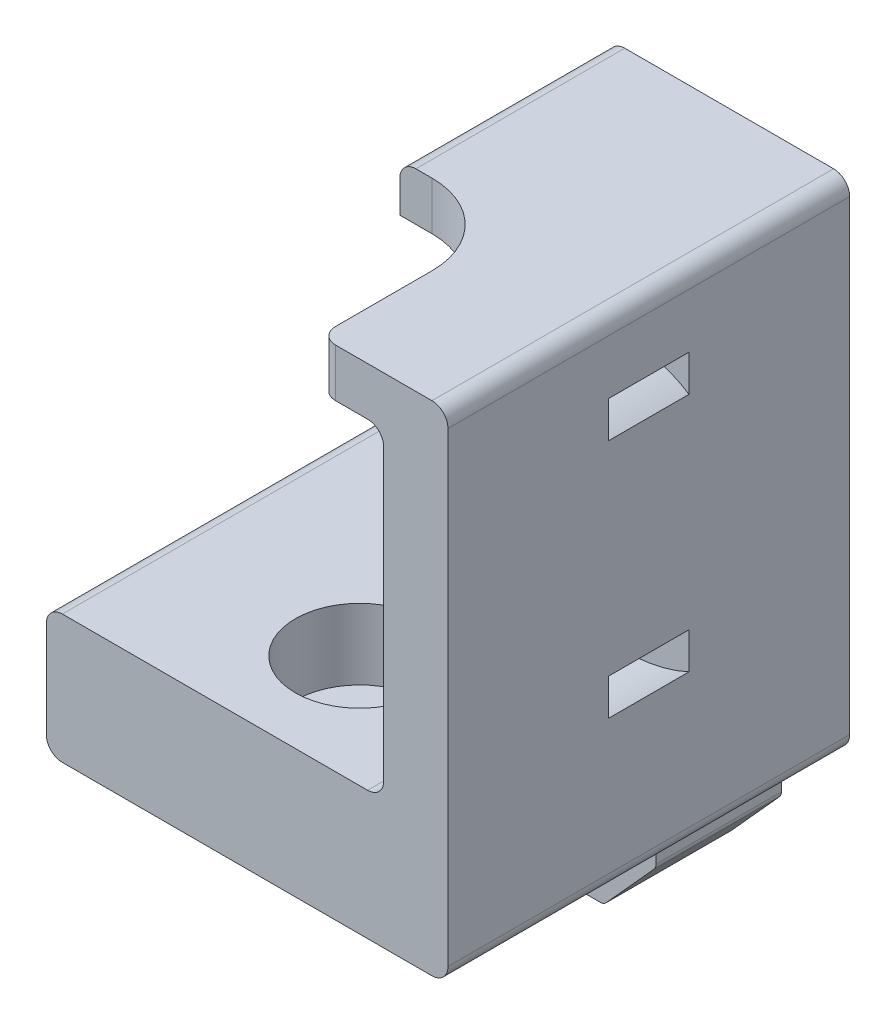
from build123d import *

# Parameters (mm, degrees)
BOSS_EXTRUDE1_DEPTH                                 = 12.5
CBORE_FOR_M4_HEX_SOCKET_HEAD_CAP_SCREW1_D           = 4.5
CBORE_FOR_M4_HEX_SOCKET_HEAD_CAP_SCREW1_DEPTH       = 8
CBORE_FOR_M4_HEX_SOCKET_HEAD_CAP_SCREW1_CBORE_D     = 8
CBORE_FOR_M4_HEX_SOCKET_HEAD_CAP_SCREW1_CBORE_DEPTH = 4.4
BOSS_EXTRUDE3_DEPTH                                 = 7.8
CUT_EXTRUDE3_REACH                                  = 44.819
SKETCH15_W                                          = 6.999999999999991
SKETCH15_H                                          = 12.000000000000002
CUT_EXTRUDE1_DEPTH                                  = 2.4
FILLET3_R                                           = 0.5
SKETCH13_W                                          = 1.9999999999999998
SKETCH13_H                                          = 5
FILLET4_START                                       = 28
FILLET4_DEPTH                                       = 3
FILLET4_START_2                                     = -12.5
FILLET4_2_DEPTH                                     = 25
FILLET4_3_DEPTH                                     = 10
FILLET4_START_3                                     = 2.5
FILLET4_4_DEPTH                                     = 10
FILLET4_START_4                                     = 27
FILLET4_5_DEPTH                                     = 5
FILLET4_START_5                                     = -13
FILLET4_6_DEPTH                                     = 26


with BuildPart() as part:
    # Sketch1 → Boss-Extrude1 (new, symmetric)
    with BuildSketch(Plane.XY):
        Polygon((-12.5, 7.999999999999993), (8.500000000000004, 7.9999999999999885), (8.500000000000004, 27.999999999999982), (-2.4999999999999987, 27.999999999999975), (-2.4999999999999987, 30.99999999999999), (12.5, 31), (12.5, -2.94e-15), (-12.5, -1.41e-15), align=None)
    extrude(amount=BOSS_EXTRUDE1_DEPTH, both=True)

    # CBORE for M4 Hex Socket Head Cap Screw1
    with Locations(Plane(origin=(1.98e-15, 7.999999999999989, 0), x_dir=(1, -1.1e-16, 0), z_dir=(1.1e-16, 1, 0))):
        with Locations((0, -5.5)):
            CounterBoreHole(CBORE_FOR_M4_HEX_SOCKET_HEAD_CAP_SCREW1_D / 2, CBORE_FOR_M4_HEX_SOCKET_HEAD_CAP_SCREW1_CBORE_D / 2, CBORE_FOR_M4_HEX_SOCKET_HEAD_CAP_SCREW1_CBORE_DEPTH, depth=CBORE_FOR_M4_HEX_SOCKET_HEAD_CAP_SCREW1_DEPTH)

    # Sketch5 → Boss-Extrude3 (add)
    with BuildSketch(Plane(origin=(0, 0, -12.5), x_dir=(-1, 0, 0), z_dir=(0, 0, -1))):
        Polygon((-4.999999999999999, -8), (5.000000000000001, -7.999999999999998), (8.249999999999996, -4.400000000000003), (8.25, -2.400000000000003), (3.9000000000000012, -2.400000000000003), (3.9, -3.06e-15), (-3.9, -4.02e-15), (-3.9000000000000004, -2.400000000000004), (-8.25, -2.400000000000005), (-8.249999999999996, -4.400000000000005), align=None)
    extrude(amount=-BOSS_EXTRUDE3_DEPTH)

    # Sketch15 → Cut-Extrude3 (cut, up to next)
    with BuildSketch(Plane(origin=(-2.151e-14, 30.999999999999993, 0), x_dir=(1, 6.9e-16, 0), z_dir=(-6.9e-16, 1, 0)), mode=Mode.PRIVATE) as cut_extrude3_sk1:
        with Locations((1.0000000000000187, -6.500000000000001)):
            Rectangle(SKETCH15_W, SKETCH15_H)
    cut_extrude3_tool1 = extrude(cut_extrude3_sk1.sketch, amount=-CUT_EXTRUDE3_REACH, mode=Mode.PRIVATE) & part.part
    add(cut_extrude3_tool1.solids().sort_by_distance((1, 31, 6.5))[0], mode=Mode.SUBTRACT)

    # Sketch6 → Cut-Extrude1 (cut)
    with BuildSketch(Plane(origin=(0, -2.400000000000003, 0), x_dir=(1, 0, 0), z_dir=(0, 1, 0))):
        with BuildLine():
            ThreePointArc((-3.900000000000001, 8.600000000000001), (-2.7577164466274824, 11.357716446627592), (1.491e-13, 12.500000000000004))
            Line((1.4921e-13, 12.5), (-3.9, 12.5))
            Line((-3.9, 12.5), (-3.9, 8.600000000000005))
        make_face()
        with BuildLine():
            Line((3.9, 4.700000000000001), (3.9000000000000004, 8.600000000000001))
            ThreePointArc((3.9000000000000026, 8.6), (2.7577164513941343, 5.842283558139062), (1.348197454e-08, 4.699999999999999))
            Line((1.348197465e-08, 4.700000000000001), (3.9, 4.700000000000001))
        make_face()
    extrude(amount=CUT_EXTRUDE1_DEPTH, mode=Mode.SUBTRACT)

    # Fillet3
    # the kernel refuses this fillet: 0.5 mm, written as the material it adds along each edge
    with BuildSketch(Plane(origin=(-3.9, -3.06e-15, -4.7), x_dir=(0, 2.38e-15, 1), z_dir=(1, -1.2e-16, 0))) as fillet3_piece_1:
        with BuildLine():
            CenterArc((FILLET3_R, FILLET3_R), FILLET3_R, 180, 90.00000000000011)
            Line((-1.19e-15, FILLET3_R), (0, 0))
            Line((0, 0), (FILLET3_R, 0))
        make_face()
    extrude(amount=3.9000000134819746)
    with BuildSketch(Plane(origin=(-3.9, -3.06e-15, -8.600000000000003), x_dir=(-1, 2.35e-15, 0), z_dir=(0, 0, 1))) as fillet3_piece_2:
        with BuildLine():
            CenterArc((FILLET3_R, FILLET3_R), FILLET3_R, 179.99999999999997, 90.00000000000017)
            Line((-2.51e-15, FILLET3_R), (0, 0))
            Line((0, 0), (FILLET3_R, 0))
        make_face()
    extrude(amount=3.900000000000003)
    with BuildSketch(Plane(origin=(3.9, -4.02e-15, -12.5), x_dir=(1, 3.15e-15, 0), z_dir=(0, 0, 1))) as fillet3_piece_3:
        with BuildLine():
            CenterArc((FILLET3_R, -FILLET3_R), FILLET3_R, 89.99999999999982, 90.00000000000017)
            Line((-1.13e-15, -FILLET3_R), (0, 0))
            Line((0, 0), (FILLET3_R, 0))
        make_face()
    extrude(amount=3.8999999999999986)
    with BuildSketch(Plane(origin=(-1.78e-15, -3.11e-15, -8.600000000000005), x_dir=(1, 0, 1.37e-15), z_dir=(1.37e-15, 0, -1))) as fillet3_piece_4:
        with BuildLine():
            CenterArc((3.9000000000000057 + FILLET3_R, FILLET3_R), FILLET3_R, 179.99999999999991, 90.00000000000011)
            Line((3.9000000000000057, FILLET3_R), (3.9000000000000057, 0))
            Line((3.9000000000000057, 0), (3.9000000000000057 + FILLET3_R, -7.8e-16))
        make_face()
    revolve(axis=Axis((-1.78e-15, -3.11e-15, -8.600000000000005), (0, -1, 0)), revolution_arc=89.99999980193317)
    with BuildSketch(Plane(origin=(-4.4e-16, -3.11e-15, -8.600000000000005), x_dir=(-1, 0, 9.1e-16), z_dir=(9.1e-16, 0, 1))) as fillet3_piece_5_section:
        with BuildLine():
            CenterArc((3.9 + FILLET3_R, FILLET3_R), FILLET3_R, 179.99999999999986, 90.00000000000011)
            Line((3.9, FILLET3_R), (3.9, 0))
            Line((3.9, 0), (3.9 + FILLET3_R, -1.11e-15))
        make_face()
    fillet3_piece_5 = revolve(axis=Axis((-4.4e-16, -3.11e-15, -8.600000000000005), (0, -1, 0)), revolution_arc=121.23139509020365, mode=Mode.PRIVATE)
    fillet3_piece_5 = split(fillet3_piece_5, bisect_by=Plane(origin=(-4.4e-16, -3.11e-15, -12.5), z_dir=(0, 0, 1)), keep=Keep.TOP, mode=Mode.PRIVATE)
    add(fillet3_piece_5)
    with BuildSketch(Plane(origin=(-5.15, -2.91e-15, -4.7), x_dir=(0, 2.38e-15, 1), z_dir=(1, -1.2e-16, 0))) as fillet3_piece_6a_section:
        with BuildLine():
            CenterArc((FILLET3_R, FILLET3_R), FILLET3_R, 180, 90.00000000000011)
            Line((-1.19e-15, FILLET3_R), (0, 0))
            Line((0, 0), (FILLET3_R, 0))
        make_face()
    fillet3_piece_6a = extrude(amount=5.150000013481975, mode=Mode.PRIVATE)
    fillet3_piece_6a = split(fillet3_piece_6a, bisect_by=Plane(origin=(-3.9, -3.6e-15, -4.7), z_dir=(-1, 5.6e-16, 0)), keep=Keep.TOP, mode=Mode.PRIVATE)
    with BuildSketch(Plane(origin=(-3.9, -3.06e-15, -8.600000000000003), x_dir=(-1, 2.35e-15, 0), z_dir=(0, 0, 1))) as fillet3_piece_6b_section:
        with BuildLine():
            CenterArc((FILLET3_R, FILLET3_R), FILLET3_R, 179.99999999999997, 90.00000000000017)
            Line((-2.51e-15, FILLET3_R), (0, 0))
            Line((0, 0), (FILLET3_R, 0))
        make_face()
    fillet3_piece_6b = extrude(amount=5.150000000000004, mode=Mode.PRIVATE)
    fillet3_piece_6b = split(fillet3_piece_6b, bisect_by=Plane(origin=(-3.9, -3.06e-15, -4.7), z_dir=(0, 0, 1)), keep=Keep.TOP, mode=Mode.PRIVATE)
    fillet3_piece_6 = fillet3_piece_6a & fillet3_piece_6b
    add(fillet3_piece_6)
    # the kernel refuses this fillet: 0.5 mm, written as the material it takes off along each edge
    with BuildSketch(Plane(origin=(-8.249999999999996, -4.400000000000003, -12.98076923076923), x_dir=(0.6701030927835051, -0.7422680412371134, 0), z_dir=(0, 0, 1))) as fillet3_2_piece_1:
        with BuildLine():
            CenterArc((FILLET3_R * 0.384615384615, FILLET3_R), FILLET3_R, 227.92497794915644, 42.07502205084347)
            Line((-FILLET3_R * 0.285487708168, FILLET3_R * 0.257731958763), (0, 0))
            Line((0, 0), (FILLET3_R * 0.384615384615, 1e-17))
        make_face()
    extrude(amount=8.761538461538459, mode=Mode.SUBTRACT)
    with BuildSketch(Plane(origin=(-5.000000000000001, -7.999999999999998, -13.055555555555557), x_dir=(1, 0, 0), z_dir=(0, 0, 1))) as fillet3_2_piece_2:
        with BuildLine():
            CenterArc((FILLET3_R * 0.444444444444, FILLET3_R), FILLET3_R, 222.07502205084361, 47.924977949156414)
            Line((-FILLET3_R * 0.297823596793, FILLET3_R * 0.329896907216), (0, 0))
            Line((0, 0), (FILLET3_R * 0.444444444444, 0))
        make_face()
    extrude(amount=8.911111111111113, mode=Mode.SUBTRACT)
    with BuildSketch(Plane(origin=(4.999999999999999, -8, -13.055555555555555), x_dir=(0.6701030927835051, 0.7422680412371134, 0), z_dir=(0, 0, 1))) as fillet3_2_piece_3:
        with BuildLine():
            CenterArc((FILLET3_R * 0.444444444444, FILLET3_R), FILLET3_R, 222.07502205084361, 47.9249779491563)
            Line((-FILLET3_R * 0.297823596793, FILLET3_R * 0.329896907216), (0, 0))
            Line((0, 0), (FILLET3_R * 0.444444444444, -1e-17))
        make_face()
    extrude(amount=8.911111111111111, mode=Mode.SUBTRACT)
    with BuildSketch(Plane(origin=(8.249999999999996, -4.400000000000005, -12.98076923076923), x_dir=(-0.6701030927835051, -0.7422680412371134, 0), z_dir=(0, 0, 1))) as fillet3_2_piece_4:
        with BuildLine():
            CenterArc((FILLET3_R * 0.384615384615, -FILLET3_R), FILLET3_R, 89.99999999999999, 42.07502205084343)
            Line((-FILLET3_R * 0.285487708168, -FILLET3_R * 0.257731958763), (0, 0))
            Line((0, 0), (FILLET3_R * 0.384615384615, -1e-17))
        make_face()
    extrude(amount=8.761538461538459, mode=Mode.SUBTRACT)
    with BuildSketch(Plane(origin=(8.25, -2.400000000000005, -13.750000000000002), x_dir=(-1, 0, 0), z_dir=(0, 0, 1))) as fillet3_2_piece_5:
        with BuildLine():
            CenterArc((FILLET3_R, FILLET3_R), FILLET3_R, 179.9999999999999, 90.00000000000011)
            Line((0, FILLET3_R), (0, 0))
            Line((0, 0), (FILLET3_R, 0))
        make_face()
    extrude(amount=10.300000000000004, mode=Mode.SUBTRACT)
    with BuildSketch(Plane(origin=(-8.25, -2.400000000000003, -13.750000000000002), x_dir=(3.55e-15, -1, 0), z_dir=(0, 0, 1))) as fillet3_2_piece_6:
        with BuildLine():
            CenterArc((FILLET3_R, FILLET3_R), FILLET3_R, 180, 89.99999999999989)
            Line((1.33e-15, FILLET3_R), (0, 0))
            Line((0, 0), (FILLET3_R, 0))
        make_face()
    extrude(amount=10.300000000000002, mode=Mode.SUBTRACT)

    # Cut-Sweep1: sweep along a path in Sketch7
    with BuildLine(Plane.XY) as cut_sweep1_path:
        EllipticalCenterArc((8.500000000000004, 17.99999999999999), 7.5, 7.5, start_angle=0, arc_size=360, rotation=-89.99999999999999)
    # Sketch13 → Cut-Sweep1 (sweep, cut)
    with BuildSketch(Plane(origin=(1.0000000000000044, 17.99999999999999, 0), x_dir=(-1, 3.3e-16, 0), z_dir=(-3.3e-16, -1, 0))):
        with Locations((0.9999999999999983, 0)):
            Rectangle(SKETCH13_W, SKETCH13_H)
    sweep(path=cut_sweep1_path.line, mode=Mode.SUBTRACT)

    # Fillet4: read off the stored shape, not the designer's step
    # Fillet4 outline → Fillet4 (add)
    with BuildSketch(Plane(origin=(0, 0, 0), x_dir=(1, 0, 0), z_dir=(0, 1, 0)).offset(FILLET4_START)):
        with BuildLine():
            Line((4.5, -0.5), (-0.5, -0.5))
            ThreePointArc((-0.5, -0.5), (3.035533906, -1.964466094), (4.5, -5.5))
            Line((4.5, -5.5), (4.5, -0.5))
        make_face()
    extrude(amount=FILLET4_DEPTH)

    # Fillet4 2 outline → Fillet4 2 (add)
    with BuildSketch(Plane.XY.offset(FILLET4_START_2)):
        with BuildLine():
            Line((8.5, 28), (7.5, 28))
            ThreePointArc((7.5, 28), (8.000468348, 27.865754834), (8.366565783, 27.499062865))
            ThreePointArc((8.366565783, 27.499062865), (8.433281246, 27.499765713), (8.5, 27.5))
            Line((8.5, 27.5), (8.5, 28))
        make_face()
        with BuildLine():
            ThreePointArc((8.5, 8.5), (8.433281246, 8.500234287), (8.366565783, 8.500937135))
            ThreePointArc((8.366565783, 8.500937135), (8.000468348, 8.134245166), (7.5, 8))
            Line((7.5, 8), (8.5, 8))
            Line((8.5, 8), (8.5, 8.5))
        make_face()
    extrude(amount=FILLET4_2_DEPTH)

    # Fillet4 3 outline → Fillet4 3 (add)
    with BuildSketch(Plane.XY.offset(FILLET4_START_2)):
        with BuildLine():
            ThreePointArc((8.5, 27.5), (8.433281246, 27.499765713), (8.366565783, 27.499062865))
            ThreePointArc((8.366565783, 27.499062865), (8.466065677, 27.258296551), (8.5, 27))
            Line((8.5, 27), (8.5, 27.5))
        make_face()
        with BuildLine():
            Line((8.5, 8.5), (8.5, 9))
            ThreePointArc((8.5, 9), (8.466065677, 8.741703449), (8.366565783, 8.500937135))
            ThreePointArc((8.366565783, 8.500937135), (8.433281246, 8.500234287), (8.5, 8.5))
        make_face()
    extrude(amount=FILLET4_3_DEPTH)

    # Fillet4 4 outline → Fillet4 4 (add)
    with BuildSketch(Plane.XY.offset(FILLET4_START_3)):
        with BuildLine():
            ThreePointArc((8.5, 27.5), (8.433281246, 27.499765713), (8.366565783, 27.499062865))
            ThreePointArc((8.366565783, 27.499062865), (8.466065677, 27.258296551), (8.5, 27))
            Line((8.5, 27), (8.5, 27.5))
        make_face()
        with BuildLine():
            Line((8.5, 8.5), (8.5, 9))
            ThreePointArc((8.5, 9), (8.466065677, 8.741703449), (8.366565783, 8.500937135))
            ThreePointArc((8.366565783, 8.500937135), (8.433281246, 8.500234287), (8.5, 8.5))
        make_face()
    extrude(amount=FILLET4_4_DEPTH)

    # Fillet4 5 outline → Fillet4 5 (cut)
    with BuildSketch(Plane(origin=(0, 0, 0), x_dir=(1, 0, 0), z_dir=(0, 1, 0)).offset(FILLET4_START_4)):
        with BuildLine():
            ThreePointArc((5.5, -12.5), (4.792893219, -12.207106781), (4.5, -11.5))
            Line((4.5, -11.5), (4.5, -12.5))
            Line((4.5, -12.5), (5.5, -12.5))
        make_face()
    extrude(amount=FILLET4_5_DEPTH, mode=Mode.SUBTRACT)

    # Fillet4 6 outline → Fillet4 6 (cut)
    with BuildSketch(Plane.XY.offset(FILLET4_START_5)):
        with BuildLine():
            Line((-2.5, 31), (-2.5, 30))
            ThreePointArc((-2.5, 30), (-2.207106781, 30.707106781), (-1.5, 31))
            Line((-1.5, 31), (-2.5, 31))
        make_face()
        with BuildLine():
            Line((12.5, 31), (11.5, 31))
            ThreePointArc((11.5, 31), (12.207106781, 30.707106781), (12.5, 30))
            Line((12.5, 30), (12.5, 31))
        make_face()
        with BuildLine():
            Line((12.5, 0), (12.5, 1))
            ThreePointArc((12.5, 1), (12.207106781, 0.292893219), (11.5, 0))
            Line((11.5, 0), (12.5, 0))
        make_face()
        with BuildLine():
            ThreePointArc((-12.5, 7), (-12.207106781, 7.707106781), (-11.5, 8))
            Line((-11.5, 8), (-12.5, 8))
            Line((-12.5, 8), (-12.5, 7))
        make_face()
        with BuildLine():
            Line((-12.5, 0), (-11.5, 0))
            ThreePointArc((-11.5, 0), (-12.207106781, 0.292893219), (-12.5, 1))
            Line((-12.5, 1), (-12.5, 0))
        make_face()
    extrude(amount=FILLET4_6_DEPTH, mode=Mode.SUBTRACT)


solid = part.part
